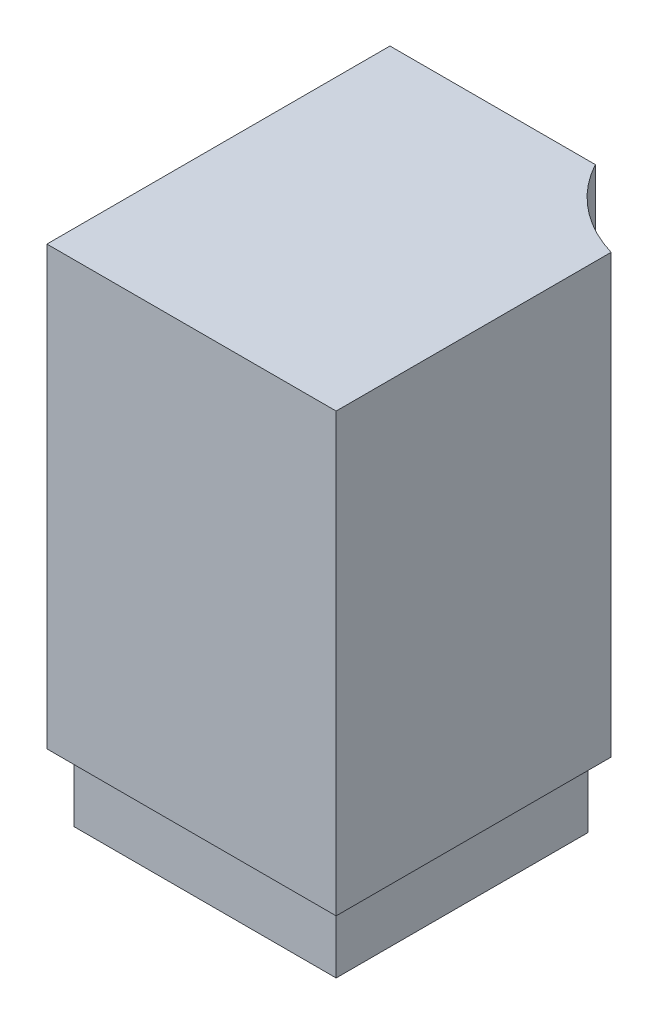
from build123d import *

# Parameters (mm, degrees)
EXTRUDE_1_DEPTH = 10
SKETCH_2_W      = 13
SKETCH_2_H      = 26
EXTRUDE_2_DEPTH = 10
EXTRUDE_3_DEPTH = 65


with BuildPart() as part:
    # ｽｹｯﾁ1 → ﾎﾞｽ - 押し出し1 (new body)
    with BuildSketch(Plane(origin=(0, 0, 0), x_dir=(1, 0, 0), z_dir=(0, 1, 0))):
        with BuildLine():
            Line((27.37858313, 0), (0, 0))
            Line((0, 0), (0, -47))
            Line((0, -47), (39, -47))
            Line((39, -47), (39, -9.563858653))
            ThreePointArc((39, -9.563858653), (32.384853214, -5.759433674), (27.37858313, 0))
        make_face()
    extrude(amount=-EXTRUDE_1_DEPTH)

    # ｽｹｯﾁ2 → ﾎﾞｽ - 押し出し2 (add)
    with BuildSketch(Plane.XZ.offset(10)):
        with Locations((19.5, 24)):
            Rectangle(SKETCH_2_W, SKETCH_2_H)
    extrude(amount=EXTRUDE_2_DEPTH)

    # ｽｹｯﾁ3 → ﾎﾞｽ - 押し出し3 (add)
    with BuildSketch(Plane(origin=(0, 0, 0), x_dir=(1, 0, 0), z_dir=(0, 1, 0))):
        with BuildLine():
            Line((-2, 2), (28.533814687, 2))
            ThreePointArc((28.533814687, 2), (33.760834734, -4.301058341), (41, -8.124611797))
            Line((41, -8.124611797), (41, -49))
            Line((41, -49), (-2, -49))
            Line((-2, -49), (-2, 2))
        make_face()
    extrude(amount=EXTRUDE_3_DEPTH)


solid = part.part
